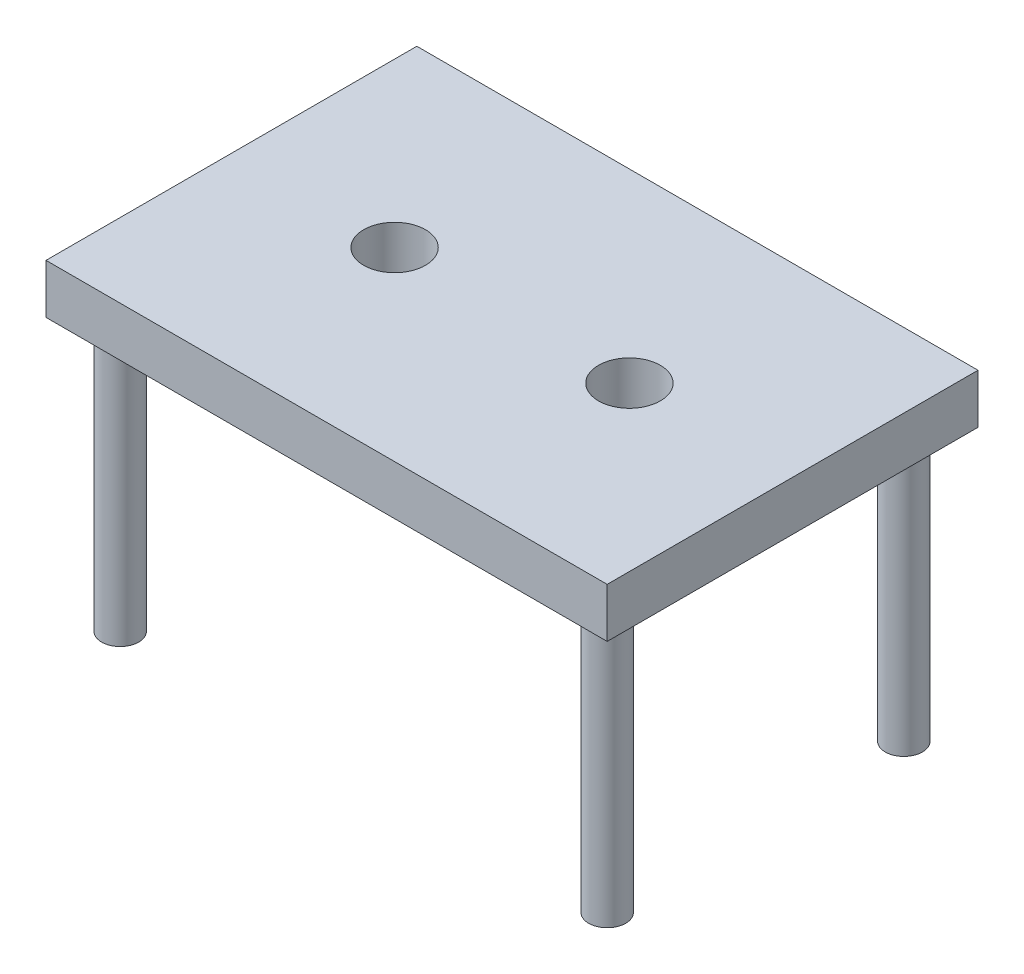
from build123d import *

# Parameters (mm, degrees)
SKETCH1_W           = 45.4
SKETCH1_H           = 30
BOSS_EXTRUDE1_DEPTH = 4
SKETCH2_R           = 2.5
CUT_EXTRUDE1_DEPTH  = 28.500727263
SKETCH3_R           = 1.5
BOSS_EXTRUDE2_DEPTH = 22
FILLET1_R           = 1.5


with BuildPart() as part:
    # Sketch1 → Boss-Extrude1 (new body)
    with BuildSketch(Plane(origin=(0, 0, 0), x_dir=(1, 0, 0), z_dir=(0, 1, 0))):
        Rectangle(SKETCH1_W, SKETCH1_H)
    extrude(amount=BOSS_EXTRUDE1_DEPTH)

    # Sketch2 → Cut-Extrude1 (cut, through all)
    with BuildSketch(Plane(origin=(0, 4, 0), x_dir=(1, 0, 0), z_dir=(0, 1, 0))):
        with Locations(Location((-9.5, 0, 0), (0, 0, 270))):
            Circle(SKETCH2_R)
        with Locations(Location((9.5, 0, 0), (0, 0, 270))):
            Circle(SKETCH2_R)
    extrude(amount=-CUT_EXTRUDE1_DEPTH, mode=Mode.SUBTRACT)

    # Sketch3 → Boss-Extrude2 (add)
    with BuildSketch(Plane.XZ):
        with Locations(Location((-19.7, 12, 0), (0, 0, 270))):
            Circle(SKETCH3_R)
        with Locations(Location((19.7, 12, 0), (0, 0, 270))):
            Circle(SKETCH3_R)
        with Locations(Location((-19.7, -12, 0), (0, 0, 270))):
            Circle(SKETCH3_R)
        with Locations(Location((19.7, -12, 0), (0, 0, 270))):
            Circle(SKETCH3_R)
    extrude(amount=BOSS_EXTRUDE2_DEPTH)

    # Fillet1
    fillet1_edges = [part.edges().sort_by_distance(p)[0] for p in [
        (-19.7, 0, 13.5),
        (19.7, 0, 13.5),
        (-19.7, 0, -10.5),
        (19.7, 0, -10.5),
    ]]
    fillet(fillet1_edges, radius=FILLET1_R - 0.0001)  # a hair under: the kernel refuses the full size


solid = part.part
